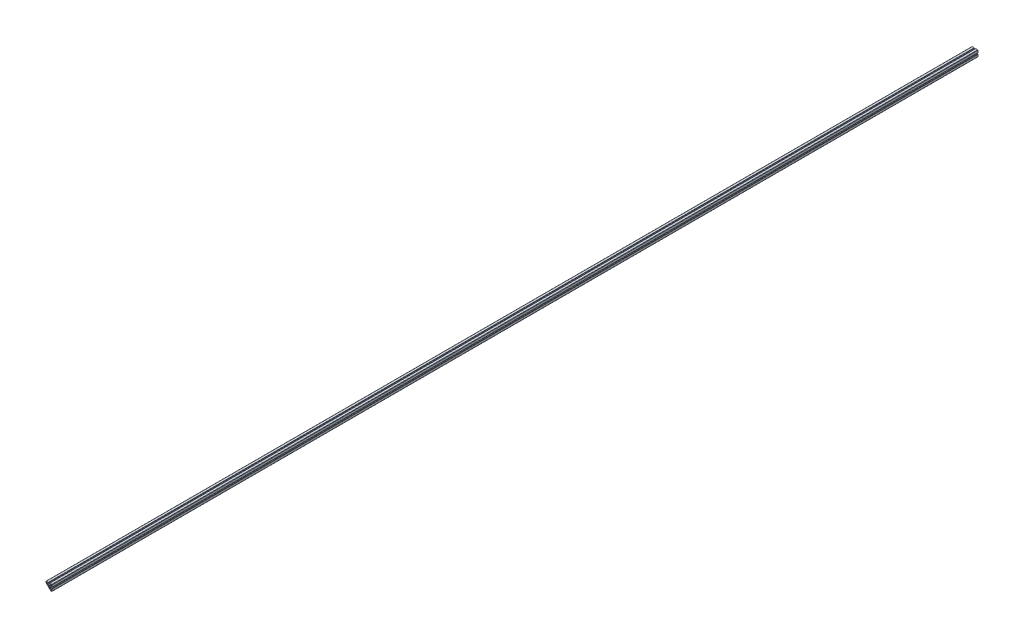
from build123d import *

# Parameters (mm, degrees)
SKETCH3_W           = 4
SKETCH3_H           = 4
BOSS_EXTRUDE1_DEPTH = 3048
FILLET1_R           = 2
FILLET3_R           = 0.5
FILLET2_START       = -3049
FILLET2_DEPTH       = 6098
FILLET2_START_2     = -3048
FILLET2_2_DEPTH     = 6096


with BuildPart() as part:
    # Sketch3 → Boss-Extrude1 (new, symmetric)
    with BuildSketch(Plane.XY):
        with BuildLine():
            Line((18.5, 18.5), (14.5, 18.5))
            Line((14.5, 18.5), (14.5, 14.5))
            Line((14.5, 14.5), (3.146625176, 3.146625176))
            ThreePointArc((3.146625176, 3.146625176), (-3.146625176, 3.146625176), (-3.146625176, -3.146625176))
            Line((-3.146625176, -3.146625176), (-4.710660172, -4.710660172))
            Line((-4.710660172, -4.710660172), (-20, 10.578679656))
            Line((-20, 10.578679656), (-20, 20))
            Line((-20, 20), (-4.05, 20))
            Line((-4.05, 20), (-4.05, 17.5))
            Line((-4.05, 17.5), (-7.05, 17.5))
            Line((-7.05, 17.5), (-7.05, 18.5))
            Line((-7.05, 18.5), (-11.2, 18.5))
            Line((-11.2, 18.5), (-11.2, 13.321320344))
            Line((-11.2, 13.321320344), (-5.478679656, 7.6))
            Line((-5.478679656, 7.6), (5.478679656, 7.6))
            Line((5.478679656, 7.6), (11.2, 13.321320344))
            Line((11.2, 13.321320344), (11.2, 18.5))
            Line((11.2, 18.5), (7.05, 18.5))
            Line((7.05, 18.5), (7.05, 17.5))
            Line((7.05, 17.5), (4.05, 17.5))
            Line((4.05, 17.5), (4.05, 20))
            Line((4.05, 20), (20, 20))
            Line((20, 20), (18.5, 18.5))
        make_face()
        Polygon((-13.321320344, 11.2), (-18.5, 11.2), (-7.6, 0.3), (-7.6, 5.478679656), align=None, mode=Mode.SUBTRACT)
        with Locations((-16.5, 16.5)):
            Rectangle(SKETCH3_W, SKETCH3_H, mode=Mode.SUBTRACT)
    extrude(amount=BOSS_EXTRUDE1_DEPTH, both=True)

    # Fillet1
    fillet1_edges = [part.edges().sort_by_distance(p)[0] for p in [
        (-20, 20, 0),
        (-11.2, 18.5, 0),
        (-5.478679656, 7.6, 0),
        (5.478679656, 7.6, 0),
        (11.2, 18.5, 0),
        (-18.5, 18.5, 0),
    ]]
    fillet(fillet1_edges, radius=FILLET1_R)

    # Fillet3
    fillet3_edges = [part.edges().sort_by_distance(p)[0] for p in [
        (-4.05, 20, 0),
        (-4.05, 17.5, 0),
        (4.05, 17.5, 0),
        (4.05, 20, 0),
        (-7.6, 5.478679656, 0),
        (-18.5, 11.2, 0),
        (-7.6, 0.3, 0),
    ]]
    fillet(fillet3_edges, radius=FILLET3_R)

    # Mirror1: part across plane


with BuildPart() as part_1:
    add(part.part)
    add(part.part.mirror(Plane(origin=(3.146625176, 3.146625176, 3048), x_dir=(0, 0, 1), z_dir=(-0.7071067811865543, 0.7071067811865408, 0))))

    # Fillet2: read off the stored shape, not the designer's step
    # Fillet2 outline → Fillet2 (cut)
    with BuildSketch(Plane.XY.offset(FILLET2_START)):
        with BuildLine():
            Line((20, 20), (18, 20))
            ThreePointArc((18, 20), (19.414213562, 19.414213562), (20, 18))
            Line((20, 18), (20, 20))
        make_face()
    extrude(amount=FILLET2_DEPTH, mode=Mode.SUBTRACT)

    # Fillet2 2 outline → Fillet2 2 (add)
    with BuildSketch(Plane.XY.offset(FILLET2_START_2)):
        with BuildLine():
            ThreePointArc((16.5, 18.5), (17.914213562, 17.914213562), (18.5, 16.5))
            Line((18.5, 16.5), (18.5, 18.5))
            Line((18.5, 18.5), (16.5, 18.5))
        make_face()
    extrude(amount=FILLET2_2_DEPTH)


solid = part_1.part
